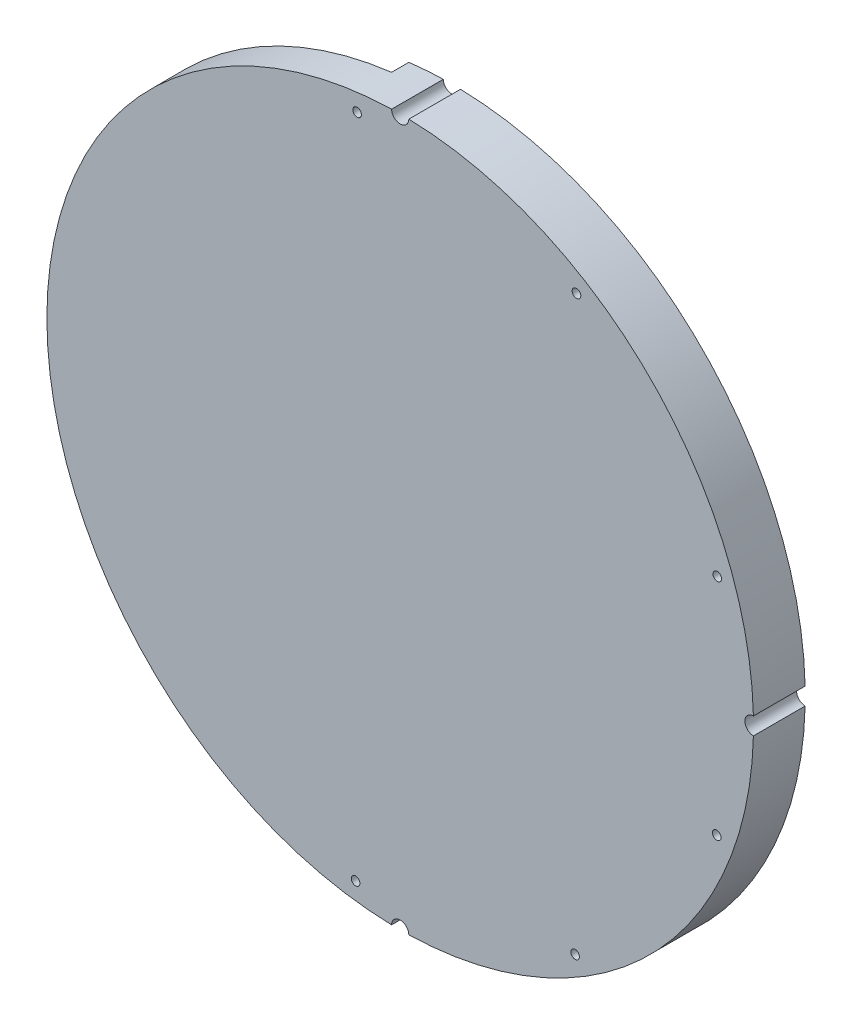
from build123d import *

# Parameters (mm, degrees)
SKETCH1_R           = 82
BOSS_EXTRUDE1_DEPTH = 8
BOSS_EXTRUDE3_START = 4
BOSS_EXTRUDE3_DEPTH = 4
FILLET1_R           = 10
SKETCH8_R           = 2
CUT_EXTRUDE4_DEPTH  = 12
CIRPATTERN4_COUNT   = 3
CIRPATTERN4_ANGLE   = 180
CUT_EXTRUDE5_START  = -12
SKETCH9_R           = 1
CUT_EXTRUDE5_DEPTH  = 38
CIRPATTERN5_COUNT   = 6
CIRPATTERN5_ANGLE   = 195


with BuildPart() as part:
    # Sketch1 → Boss-Extrude1 (new body)
    with BuildSketch(Plane.XY):
        Circle(SKETCH1_R)
    extrude(amount=BOSS_EXTRUDE1_DEPTH)

    # Sketch3 → Boss-Extrude3 (add)
    with BuildSketch(Plane(origin=(0, 0, 0), x_dir=(-1, 0, 0), z_dir=(0, 0, -1)).offset(BOSS_EXTRUDE3_START)):
        with BuildLine():
            Line((10, 81.387959798), (10, 74.8348181))
            ThreePointArc((10, 74.8348181), (-75.5, 0), (10, -74.8348181))
            Line((10, -74.8348181), (10, -81.387959798))
            ThreePointArc((10, -81.387959798), (-82, 0), (10, 81.387959798))
        make_face()
    extrude(amount=-BOSS_EXTRUDE3_DEPTH)

    # Fillet1
    # the kernel refuses this fillet: 10 mm, written as the material it takes off along each edge
    with BuildSketch(Plane(origin=(-10, 74.8348181, -27.110945108), x_dir=(0, 1, 0), z_dir=(0, 0, 1))) as fillet1_piece_1:
        with BuildLine():
            CenterArc((10.660627219, -9.117486644), FILLET1_R, 114.251866349, 66.339539365)
            ThreePointArc((0.66115993, -9.22070458), (0.471837745, -4.600223565), (0, 0))
            Line((0, 0), (6.553141698, 0))
        make_face()
    extrude(amount=27.110945108, mode=Mode.SUBTRACT)
    with BuildSketch(Plane(origin=(-10, -74.8348181, -27.110945108), x_dir=(0, -1, 0), z_dir=(0, 0, 1))) as fillet1_piece_2:
        with BuildLine():
            CenterArc((10.660627219, 9.117486644), FILLET1_R, 179.408594286, 66.339539365)
            ThreePointArc((0.66115993, 9.22070458), (0.471837745, 4.600223565), (0, 0))
            Line((0, 0), (6.553141698, 0))
        make_face()
    extrude(amount=27.110945108, mode=Mode.SUBTRACT)

    # Sketch8 → Cut-Extrude4 (cut)
    with BuildSketch(Plane(origin=(0, 0, -4), x_dir=(-1, 0, 0), z_dir=(0, 0, -1))):
        with Locations((0, 82)):
            Circle(SKETCH8_R)
    cut_extrude4 = extrude(amount=-CUT_EXTRUDE4_DEPTH, mode=Mode.SUBTRACT)

    # CirPattern4: Cut-Extrude4 ×3 about axis
    cirpattern4_axis = Axis((0, 0, 0), (0, 0, -1))
    for i in range(1, CIRPATTERN4_COUNT):
        add(cut_extrude4.rotate(cirpattern4_axis, i * CIRPATTERN4_ANGLE / (CIRPATTERN4_COUNT - 1)), mode=Mode.SUBTRACT)

    # Sketch9 → Cut-Extrude5 (cut)
    with BuildSketch(Plane(origin=(0, 0, 0), x_dir=(-1, 0, 0), z_dir=(0, 0, -1)).offset(CUT_EXTRUDE5_START)):
        with Locations(Location((10, 77.356318423, 0), (0, 0, 180))):
            Circle(SKETCH9_R)
    cut_extrude5 = extrude(amount=CUT_EXTRUDE5_DEPTH, mode=Mode.SUBTRACT)

    # CirPattern5: Cut-Extrude5 ×6 about axis
    cirpattern5_axis = Axis((0, 0, 0), (0, 0, -1))
    for i in range(1, CIRPATTERN5_COUNT):
        add(cut_extrude5.rotate(cirpattern5_axis, i * CIRPATTERN5_ANGLE / (CIRPATTERN5_COUNT - 1)), mode=Mode.SUBTRACT)


solid = part.part
